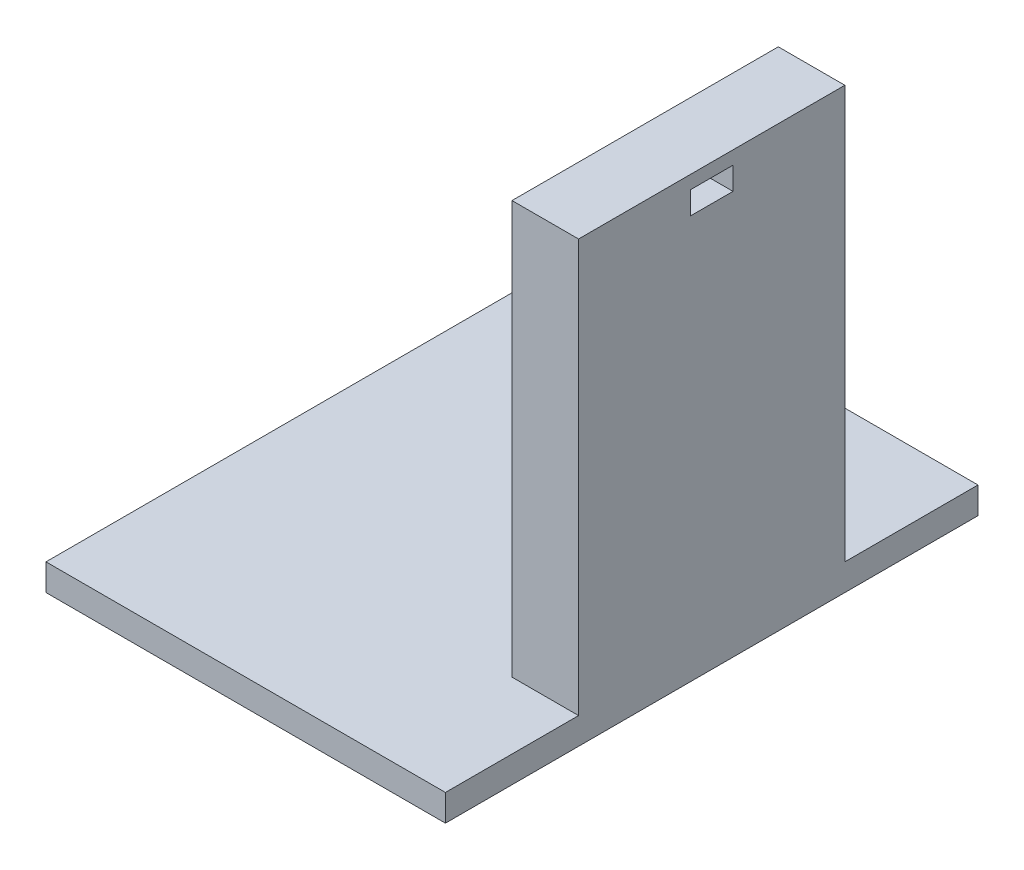
from build123d import *

# Parameters (mm, degrees)
ESQUISSE2_W             = 150
ESQUISSE2_H             = 200
BOSS_EXTRU_6_DEPTH      = 10
ESQUISSE4_W             = 25
ESQUISSE4_H             = 100
BOSS_EXTRU_7_DEPTH      = 160
ESQUISSE8_W             = 24.4
ESQUISSE8_H             = 20.028297961
ENL_V_MAT_EXTRU_1_DEPTH = 12.2
ESQUISSE9_W             = 12
ESQUISSE9_H             = 5
ENL_V_MAT_EXTRU_2_DEPTH = 42.2
ESQUISSE11_W            = 16
ESQUISSE11_H            = 8.51414898
ENL_V_MAT_EXTRU_3_DEPTH = 42.2
ENL_V_MAT_EXTRU_6_DEPTH = 12.2
ESQUISSE13_W            = 25
ESQUISSE13_H            = 100
BOSS_EXTRU_8_DEPTH      = 5
ESQUISSE14_W            = 25.4
ESQUISSE14_H            = 0.5
ENL_V_MAT_EXTRU_7_DEPTH = 12.2


with BuildPart() as part:
    # Esquisse2 → Boss.-Extru.6 (new body)
    with BuildSketch(Plane(origin=(0, 0, 0), x_dir=(1, 0, 0), z_dir=(0, 1, 0))):
        with Locations((-20.308131119, 81.7)):
            Rectangle(ESQUISSE2_W, ESQUISSE2_H)
    extrude(amount=BOSS_EXTRU_6_DEPTH)

    # Esquisse4 → Boss.-Extru.7 (add)
    with BuildSketch(Plane(origin=(0, 0, 0), x_dir=(1, 0, 0), z_dir=(0, 1, 0))):
        with Locations((42.191868881, 81.7)):
            Rectangle(ESQUISSE4_W, ESQUISSE4_H)
    extrude(amount=BOSS_EXTRU_7_DEPTH)

    # Esquisse8 → Enlèv. mat.-Extru.1 (cut)
    with BuildSketch(Plane.ZY.offset(-29.691868881)):
        with Locations((-81.7, 149.985851019)):
            Rectangle(ESQUISSE8_W, ESQUISSE8_H)
    extrude(amount=-ENL_V_MAT_EXTRU_1_DEPTH, mode=Mode.SUBTRACT)

    # Esquisse9 → Enlèv. mat.-Extru.2 (cut)
    with BuildSketch(Plane.ZY.offset(-41.891868881)):
        with Locations((-81.7, 155.98585102)):
            Rectangle(ESQUISSE9_W, ESQUISSE9_H)
    extrude(amount=-ENL_V_MAT_EXTRU_2_DEPTH, mode=Mode.SUBTRACT)

    # Esquisse11 → Enlèv. mat.-Extru.3 (cut)
    with BuildSketch(Plane.ZY.offset(-41.891868881)):
        with Locations((-81.7, 155.74292551)):
            Rectangle(ESQUISSE11_W, ESQUISSE11_H)
    extrude(amount=-ENL_V_MAT_EXTRU_3_DEPTH, mode=Mode.SUBTRACT)

    # Esquisse12 → Enlèv. mat.-Extru.6 (cut)
    with BuildSketch(Plane.ZY.offset(-29.691868881)):
        Polygon((-94.4, 160), (-94.4, 139.97), (-93.9, 139.971702039), (-93.9, 160), align=None)
        Polygon((-69, 139.97), (-69, 160), (-69.5, 160), (-69.5, 139.971702039), align=None)
    extrude(amount=-ENL_V_MAT_EXTRU_6_DEPTH, mode=Mode.SUBTRACT)

    # Esquisse13 → Boss.-Extru.8 (add)
    with BuildSketch(Plane(origin=(0, 160, 0), x_dir=(1, 0, 0), z_dir=(0, 1, 0))):
        with Locations((42.191868881, 81.7)):
            Rectangle(ESQUISSE13_W, ESQUISSE13_H)
    extrude(amount=BOSS_EXTRU_8_DEPTH)

    # Esquisse14 → Enlèv. mat.-Extru.7 (cut)
    with BuildSketch(Plane.ZY.offset(-29.691868881)):
        with Locations((-81.7, 160.25)):
            Rectangle(ESQUISSE14_W, ESQUISSE14_H)
    extrude(amount=-ENL_V_MAT_EXTRU_7_DEPTH, mode=Mode.SUBTRACT)


solid = part.part
